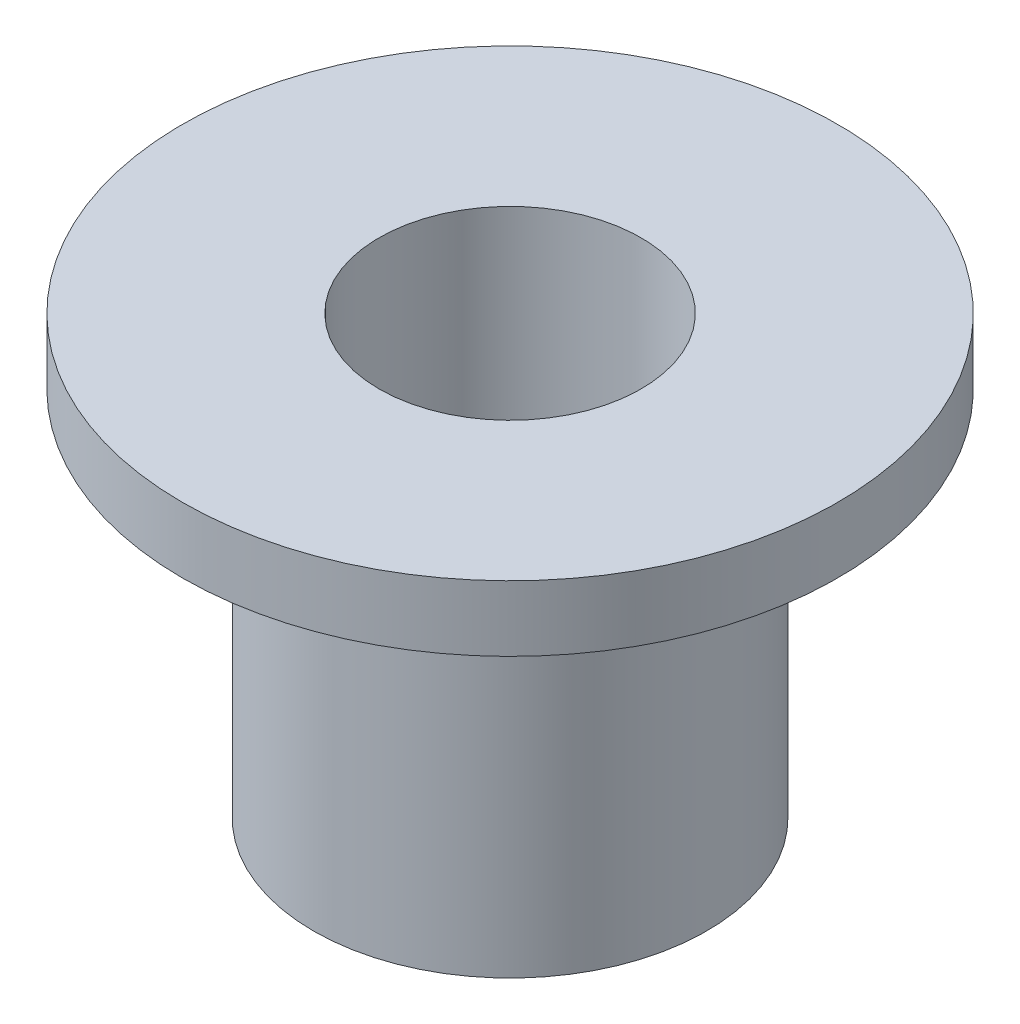
from build123d import *

# Parameters (mm, degrees)
SKETCH1_R           = 3.75
SKETCH1_R_2         = 1.5
BOSS_EXTRUDE1_DEPTH = 0.75
BOSS_EXTRUDE2_START = -5
SKETCH2_R           = 2.25
SKETCH2_R_2         = 1.5
BOSS_EXTRUDE2_DEPTH = 5


with BuildPart() as part:
    # Sketch1 → Boss-Extrude1 (new body)
    with BuildSketch(Plane(origin=(0, 0, 0), x_dir=(1, 0, 0), z_dir=(0, 1, 0))):
        Circle(SKETCH1_R)
        Circle(SKETCH1_R_2, mode=Mode.SUBTRACT)
    extrude(amount=BOSS_EXTRUDE1_DEPTH)

    # Sketch2 → Boss-Extrude2 (add)
    with BuildSketch(Plane(origin=(0, 0.75, 0), x_dir=(1, 0, 0), z_dir=(0, 1, 0)).offset(BOSS_EXTRUDE2_START)):
        Circle(SKETCH2_R)
        Circle(SKETCH2_R_2, mode=Mode.SUBTRACT)
    extrude(amount=BOSS_EXTRUDE2_DEPTH)


solid = part.part
